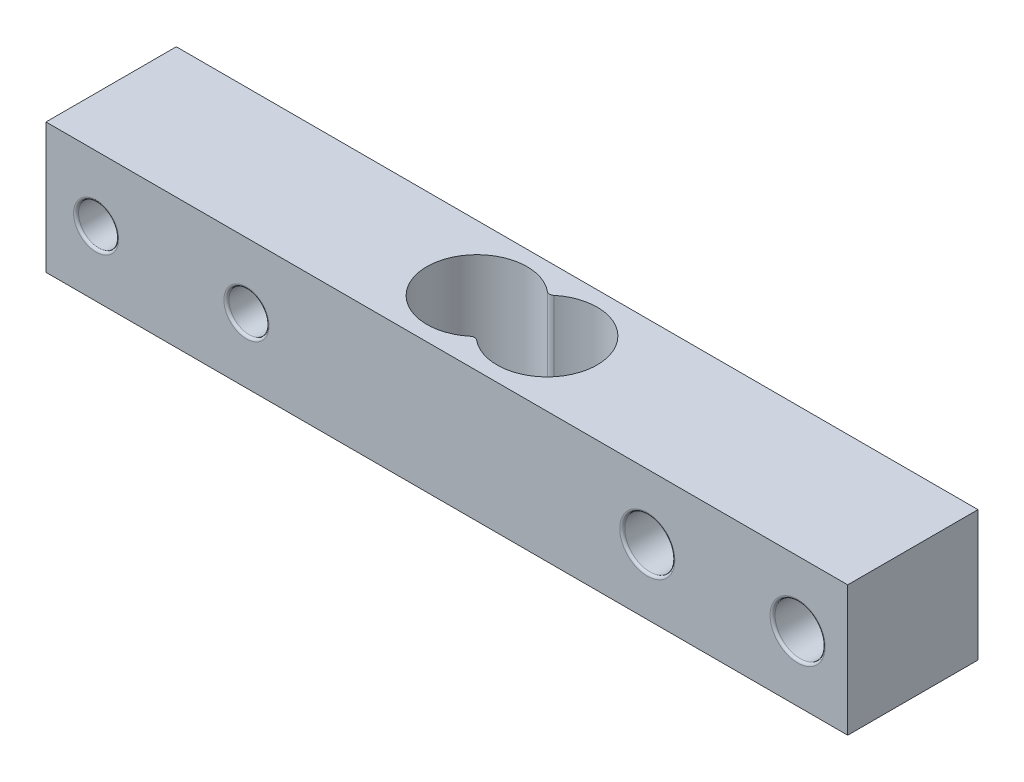
from build123d import *

# Parameters (mm, degrees)
SKETCH1_W                  = 80
SKETCH1_H                  = 13
BOSS_EXTRUDE1_DEPTH        = 13
F_5_0_5_DIAMETER_HOLE1_D   = 5
F_4_0_4_DIAMETER_HOLE1_D   = 4
F_4_0_4_DIAMETER_HOLE2_D   = 4
F_10_0_10_DIAMETER_HOLE1_D = 10
F_10_0_10_DIAMETER_HOLE2_D = 10
FILLET1_R                  = 0.25
FILLET2_R                  = 0.5


with BuildPart() as part:
    # Sketch1 → Boss-Extrude1 (new body)
    with BuildSketch(Plane.XZ):
        with Locations((12.020909698, -7.053860091)):
            Rectangle(SKETCH1_W, SKETCH1_H)
    extrude(amount=-BOSS_EXTRUDE1_DEPTH)

    # Ø5.0 (5) Diameter Hole1 (through all)
    with Locations(Plane.XY.offset(-0.553860091)):
        with Locations((32.020909698, 6.5), (47.020909698, 6.5)):
            Hole(F_5_0_5_DIAMETER_HOLE1_D / 2)

    # Ø4.0 (4) Diameter Hole1 (through all)
    with Locations(Plane.XY.offset(-0.553860091)):
        with Locations((-7.979090302, 6.5)):
            Hole(F_4_0_4_DIAMETER_HOLE1_D / 2)

    # Ø4.0 (4) Diameter Hole2 (through all)
    with Locations(Plane(origin=(0, 0, -13.553860091), x_dir=(-1, 0, 0), z_dir=(0, 0, -1))):
        with Locations((22.979090302, 6.5)):
            Hole(F_4_0_4_DIAMETER_HOLE2_D / 2)

    # Ø10.0 (10) Diameter Hole1 (through all)
    with Locations(Plane(origin=(0, 13, 0), x_dir=(1, 0, 0), z_dir=(0, 1, 0))):
        with Locations((8.520909698, 7.053860091)):
            Hole(F_10_0_10_DIAMETER_HOLE1_D / 2)

    # Ø10.0 (10) Diameter Hole2 (through all)
    with Locations(Plane(origin=(0, 0, 0), x_dir=(-1, 0, 0), z_dir=(0, -1, 0))):
        with Locations((-15.520909698, 7.053860091)):
            Hole(F_10_0_10_DIAMETER_HOLE2_D / 2)

    # Fillet1
    fillet1_edges = [part.edges().sort_by_distance(p)[0] for p in [
        (-5.979090302, 6.5, -13.553860091),
        (-5.979090302, 6.5, -0.553860091),
        (34.520909698, 6.5, -13.553860091),
        (49.520909698, 6.5, -13.553860091),
        (34.520909698, 6.5, -0.553860091),
        (-24.979090302, 6.5, -0.553860091),
        (49.520909698, 6.5, -0.553860091),
        (-24.979090302, 6.5, -13.553860091),
    ]]
    fillet(fillet1_edges, radius=FILLET1_R)

    # Fillet2
    fillet2_edges = [part.edges().sort_by_distance(p)[0] for p in [
        (12.020909698, 6.5, -10.624574305),
        (12.020909698, 6.5, -3.483145877),
    ]]
    fillet(fillet2_edges, radius=FILLET2_R)


solid = part.part
